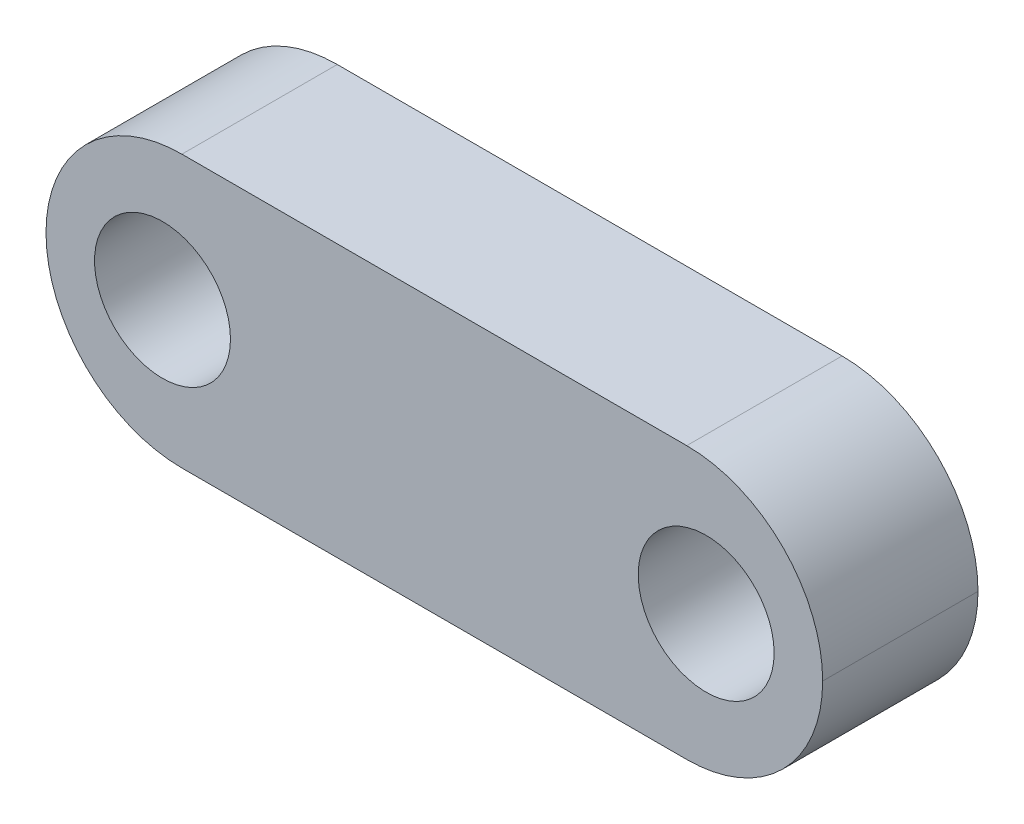
from build123d import *

# Parameters (mm, degrees)
SKETCH1_W           = 20
SKETCH1_H           = 7
SKETCH1_R           = 1.75
BOSS_EXTRUDE1_DEPTH = 4
FILLET1_R           = 3.5


with BuildPart() as part:
    # Sketch1 → Boss-Extrude1 (new body)
    with BuildSketch(Plane.XY):
        Rectangle(SKETCH1_W, SKETCH1_H)
        with Locations((-7, 0)):
            Circle(SKETCH1_R, mode=Mode.SUBTRACT)
        with Locations((7, 0)):
            Circle(SKETCH1_R, mode=Mode.SUBTRACT)
    extrude(amount=BOSS_EXTRUDE1_DEPTH)

    # Fillet1
    fillet1_edges = [part.edges().sort_by_distance(p)[0] for p in [
        (-10, 3.5, 2),
        (-10, -3.5, 2),
        (10, -3.5, 2),
        (10, 3.5, 2),
    ]]
    fillet(fillet1_edges, radius=FILLET1_R - 0.0001)  # a hair under: the kernel refuses the full size


solid = part.part
